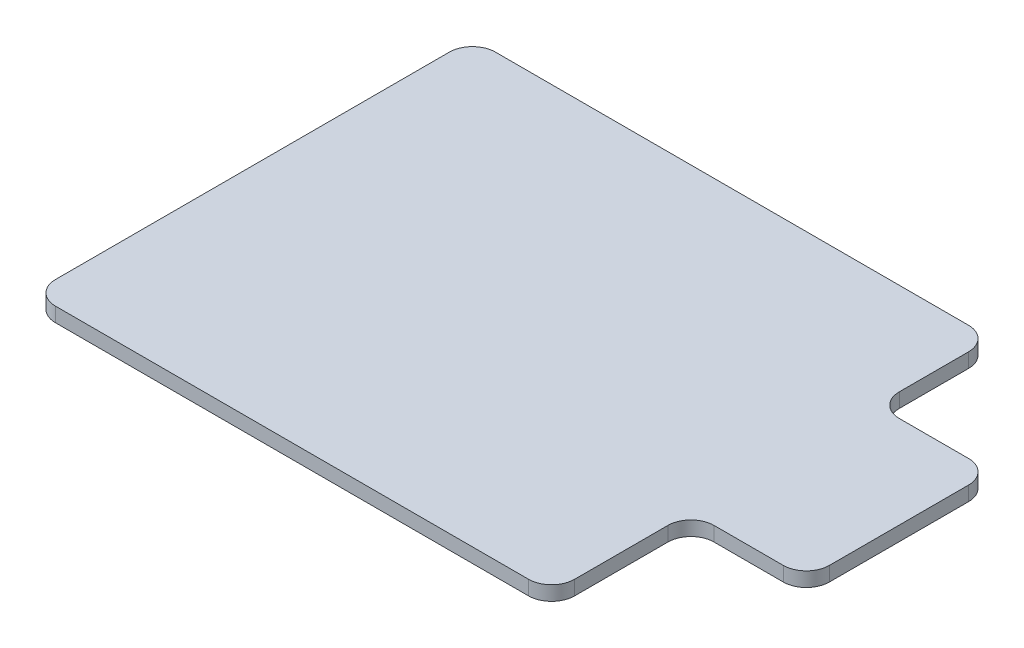
from build123d import *

# Parameters (mm, degrees)
BOSS_EXTRUDE1_DEPTH = 1.5875
FILLET1_R           = 2.54


with BuildPart() as part:
    # Sketch1 → Boss-Extrude1 (new body)
    with BuildSketch(Plane(origin=(0, 0, 0), x_dir=(1, 0, 0), z_dir=(0, 1, 0))):
        Polygon((0, 0), (0, -48.432260883), (57.15, -48.432260883), (57.15, -33.090501198), (69.85, -33.090501198), (69.85, -12.7), (57.15, -12.7), (57.15, 0), align=None)
    extrude(amount=BOSS_EXTRUDE1_DEPTH)

    # Fillet1
    fillet1_edges = [part.edges().sort_by_distance(p)[0] for p in [
        (0, 0.79375, 48.432260883),
        (0, 0.79375, 0),
        (57.15, 0.79375, 0),
        (57.15, 0.79375, 48.432260883),
        (69.85, 0.79375, 33.090501198),
        (69.85, 0.79375, 12.7),
        (57.15, 0.79375, 33.090501198),
        (57.15, 0.79375, 12.7),
    ]]
    fillet(fillet1_edges, radius=FILLET1_R)


solid = part.part
